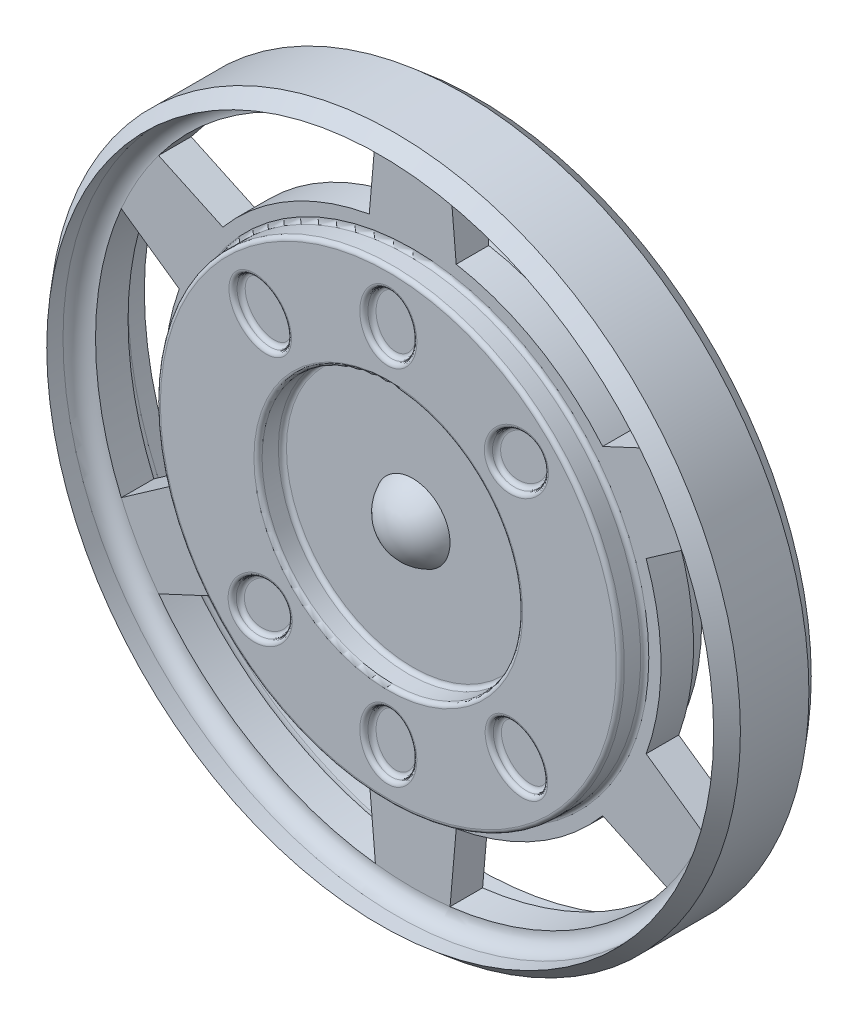
from build123d import *

# Parameters (mm, degrees)
CUT_EXTRUDE1_DEPTH       = 154.42314884
CIRPATTERN1_COUNT        = 6
SKETCH3_RX               = 9.525
SKETCH3_RY               = 7.62
CUT_EXTRUDE2_DEPTH       = 2.54
CIRPATTERN2_COUNT        = 3
CIRPATTERN2_ANGLE        = 90
MIRROR1_COPY_1_SKETCH_RX = 9.525
MIRROR1_COPY_1_SKETCH_RY = 7.62
MIRROR1_COPY_1_DEPTH     = 2.54
MIRROR1_COPY_2_SKETCH_RX = 9.525
MIRROR1_COPY_2_SKETCH_RY = 7.62
MIRROR1_COPY_2_DEPTH     = 2.54
FILLET4_R                = 1.27


with BuildPart() as part:
    # Sketch1 → Revolve1 (revolve)
    with BuildSketch(Plane(origin=(0, 0, 0), x_dir=(0, 0, -1), z_dir=(1, 0, 0)), mode=Mode.PRIVATE) as revolve1_sk:
        with BuildLine():
            Line((-12.7, 0), (12.7, 0))
            ThreePointArc((12.7, 0), (10.625582337, 6.95607648), (5.08, 11.639742265))
            Line((5.08, 11.639742265), (5.08, 40.70319283))
            Line((5.08, 40.70319283), (12.7, 40.70319283))
            Line((12.7, 40.70319283), (12.7, 72.45319283))
            Line((12.7, 72.45319283), (5.08, 72.45319283))
            Line((5.08, 72.45319283), (5.08, 99.06))
            ThreePointArc((5.08, 99.06), (6.567897552, 102.652102448), (10.16, 104.14))
            Line((10.16, 104.14), (15.24, 104.14))
            Line((15.24, 104.14), (10.699418812, 107.95))
            Line((10.699418812, 107.95), (-10.699418812, 107.95))
            Line((-10.699418812, 107.95), (-15.24, 104.14))
            Line((-15.24, 104.14), (-10.16, 104.14))
            ThreePointArc((-10.16, 104.14), (-6.567897552, 102.652102448), (-5.08, 99.06))
            Line((-5.08, 99.06), (-5.08, 72.45319283))
            Line((-5.08, 72.45319283), (-12.7, 72.45319283))
            Line((-12.7, 72.45319283), (-12.7, 40.70319283))
            Line((-12.7, 40.70319283), (-5.08, 40.70319283))
            Line((-5.08, 40.70319283), (-5.08, 11.639742265))
            ThreePointArc((-5.08, 11.639742265), (-10.625582337, 6.95607648), (-12.7, 0))
        make_face()
    revolve(revolve1_sk.sketch.rotate(Axis((0, 0, 12.7), (0, 0, -1)), 90), axis=Axis((0, 0, 12.7), (0, 0, -1)))

    # Sketch2 → Cut-Extrude1 (cut, symmetric)
    with BuildSketch(Plane.XY):
        with BuildLine():
            ThreePointArc((-72.898, -26.406014209), (-76.365603125, -13.404874104), (-77.53319283, 0))
            Line((-77.53319283, 0), (-99.06, 0))
            ThreePointArc((-99.06, 0), (-97.028978951, -19.956473731), (-91.019199601, -39.09461477))
            Line((-91.019199601, -39.09461477), (-72.898, -26.406014209))
        make_face()
        with BuildLine():
            Line((-99.06, 0), (-77.53319283, 0))
            ThreePointArc((-77.53319283, 0), (-76.365603125, 13.404874104), (-72.898, 26.406014209))
            Line((-72.898, 26.406014209), (-91.019199601, 39.09461477))
            ThreePointArc((-91.019199601, 39.09461477), (-97.028978951, 19.956473731), (-99.06, 0))
        make_face()
    cut_extrude1 = extrude(amount=CUT_EXTRUDE1_DEPTH, both=True, mode=Mode.SUBTRACT)

    # CirPattern1: Cut-Extrude1 ×6 about axis
    cirpattern1_axis = Axis((0, 0, 0), (0, 0, 1))
    for i in range(1, CIRPATTERN1_COUNT):
        add(cut_extrude1.rotate(cirpattern1_axis, i * 360 / CIRPATTERN1_COUNT), mode=Mode.SUBTRACT)

    # Sketch3 → Cut-Extrude2 (cut)
    with BuildSketch(Plane.XY.offset(12.7)):
        with Locations(Location((-40.006823817, 40.006823817), (0, 0, 131.138755358))):
            Ellipse(SKETCH3_RX, SKETCH3_RY)
        with Locations(Location((40.006823817, -40.006823817), (0, 0, -48.861244642))):
            Ellipse(SKETCH3_RX, SKETCH3_RY)
    cut_extrude2 = extrude(amount=-CUT_EXTRUDE2_DEPTH, mode=Mode.SUBTRACT)

    # CirPattern2: Cut-Extrude2 ×3 about axis
    cirpattern2_axis = Axis((0, 0, 12.7), (0, 0, -1))
    for i in range(1, CIRPATTERN2_COUNT):
        add(cut_extrude2.rotate(cirpattern2_axis, i * CIRPATTERN2_ANGLE / (CIRPATTERN2_COUNT - 1)), mode=Mode.SUBTRACT)

    # Mirror1: Cut-Extrude2 across plane
    add(cut_extrude2.mirror(Plane.XY), mode=Mode.SUBTRACT)

    # Mirror1 copy 1 sketch → Mirror1 copy 1 (cut)
    with BuildSketch(Plane(origin=(0, 0, -12.7), x_dir=(0.7071067811865462, -0.7071067811865488, 0), z_dir=(0, 0, -1))):
        with Locations(Location((-40.006823817, -40.006823817), (0, 0, -131.138755358))):
            Ellipse(MIRROR1_COPY_1_SKETCH_RX, MIRROR1_COPY_1_SKETCH_RY)
        with Locations(Location((40.006823817, 40.006823817), (0, 0, 48.861244642))):
            Ellipse(MIRROR1_COPY_1_SKETCH_RX, MIRROR1_COPY_1_SKETCH_RY)
    extrude(amount=-MIRROR1_COPY_1_DEPTH, mode=Mode.SUBTRACT)

    # Mirror1 copy 2 sketch → Mirror1 copy 2 (cut)
    with BuildSketch(Plane(origin=(0, 0, -12.7), x_dir=(0, -1, 0), z_dir=(0, 0, -1))):
        with Locations(Location((-40.006823817, -40.006823817), (0, 0, -131.138755358))):
            Ellipse(MIRROR1_COPY_2_SKETCH_RX, MIRROR1_COPY_2_SKETCH_RY)
        with Locations(Location((40.006823817, 40.006823817), (0, 0, 48.861244642))):
            Ellipse(MIRROR1_COPY_2_SKETCH_RX, MIRROR1_COPY_2_SKETCH_RY)
    extrude(amount=-MIRROR1_COPY_2_DEPTH, mode=Mode.SUBTRACT)

    # Fillet4
    fillet4_edges = [part.edges().sort_by_distance(p)[0] for p in [
        (-40.70319283, 0, 5.08),
        (-40.70319283, 0, 12.7),
        (-72.45319283, 0, 12.7),
        (-72.45319283, 0, 5.08),
        (-33.740470982, 32.833369479, 10.16),
        (-33.740470982, 32.833369479, 12.7),
        (33.740470982, -32.833369479, 10.16),
        (33.740470982, -32.833369479, 12.7),
        (-32.833369479, -33.740470982, 10.16),
        (-32.833369479, -33.740470982, 12.7),
        (32.833369479, 33.740470982, 10.16),
        (32.833369479, 33.740470982, 12.7),
        (0.641417624, -47.074814039, 10.16),
        (0.641417624, -47.074814039, 12.7),
        (-0.641417624, 47.074814039, 10.16),
        (-0.641417624, 47.074814039, 12.7),
    ]]
    fillet(fillet4_edges, radius=FILLET4_R - 0.0001)  # a hair under: the kernel refuses the full size


solid = part.part
